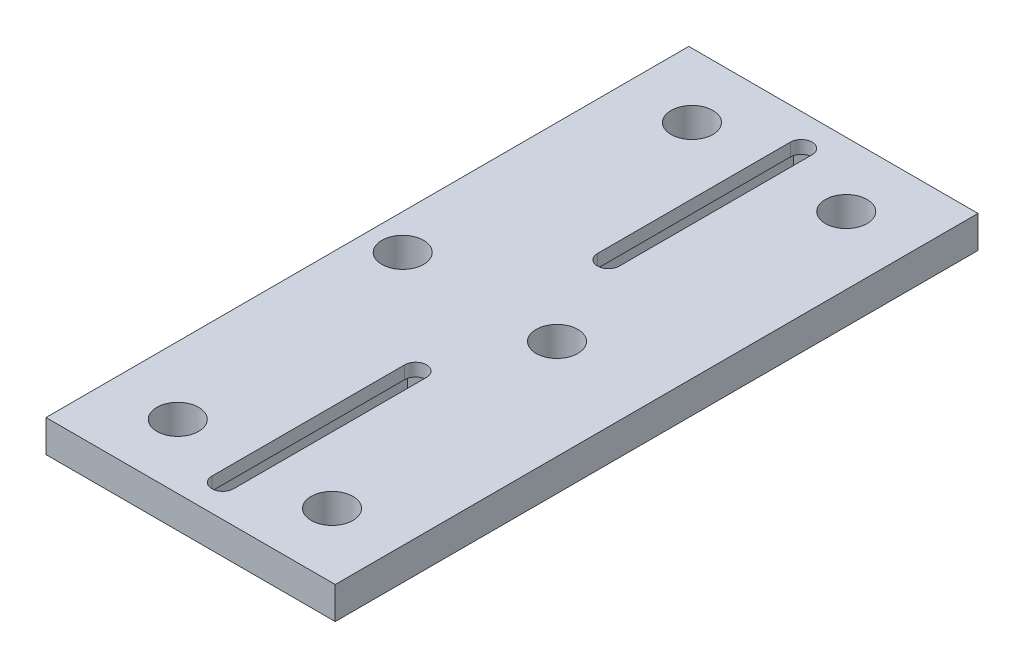
from build123d import *

# Parameters (mm, degrees)
SKETCH1_W           = 45
SKETCH1_H           = 100
SKETCH1_R           = 3.25
BOSS_EXTRUDE1_DEPTH = 5
CUT_EXTRUDE1_DEPTH  = 2
CUT_EXTRUDE2_REACH  = 56.911


with BuildPart() as part:
    # Sketch1 → Boss-Extrude1 (new body)
    with BuildSketch(Plane(origin=(0, 0, 0), x_dir=(1, 0, 0), z_dir=(0, 1, 0))):
        Rectangle(SKETCH1_W, SKETCH1_H)
        with Locations((-12, 40)):
            Circle(SKETCH1_R, mode=Mode.SUBTRACT)
        with Locations((12, 40)):
            Circle(SKETCH1_R, mode=Mode.SUBTRACT)
        with Locations((12, -40)):
            Circle(SKETCH1_R, mode=Mode.SUBTRACT)
        with Locations((-12, -40)):
            Circle(SKETCH1_R, mode=Mode.SUBTRACT)
        with Locations((7, 0)):
            Circle(SKETCH1_R, mode=Mode.SUBTRACT)
        with Locations((-17, 0)):
            Circle(SKETCH1_R, mode=Mode.SUBTRACT)
    extrude(amount=BOSS_EXTRUDE1_DEPTH)

    # Sketch2 → Cut-Extrude1 (cut)
    with BuildSketch(Plane(origin=(0, 5, 0), x_dir=(1, 0, 0), z_dir=(0, 1, 0))):
        with BuildLine():
            Line((1.7, 45), (1.7, 15))
            ThreePointArc((1.7, 15), (0, 13.3), (-1.7, 15))
            Line((-1.7, 15), (-1.7, 45))
            ThreePointArc((-1.7, 45), (0, 46.7), (1.7, 45))
        make_face()
    cut_extrude1 = extrude(amount=-CUT_EXTRUDE1_DEPTH, mode=Mode.SUBTRACT)

    # Sketch3 → Cut-Extrude2 (cut, up to next)
    with BuildSketch(Plane(origin=(0, 3, 0), x_dir=(1, 0, 0), z_dir=(0, 1, 0)), mode=Mode.PRIVATE) as cut_extrude2_sk1:
        Polygon((2.9, 46.674315781), (0, 48.348631561), (-2.9, 46.674315781), (-2.9, 13.325684219), (0, 11.651368439), (2.9, 13.325684219), align=None)
    cut_extrude2_tool1 = extrude(cut_extrude2_sk1.sketch, amount=-CUT_EXTRUDE2_REACH, mode=Mode.PRIVATE) & part.part
    cut_extrude2 = cut_extrude2_tool1.solids().sort_by_distance((0, 3, -30))[0]
    add(cut_extrude2, mode=Mode.SUBTRACT)

    # Mirror1: Cut-Extrude1, Cut-Extrude2 across plane
    add(cut_extrude1.mirror(Plane.XY), mode=Mode.SUBTRACT)
    add(cut_extrude2.mirror(Plane.XY), mode=Mode.SUBTRACT)


solid = part.part
